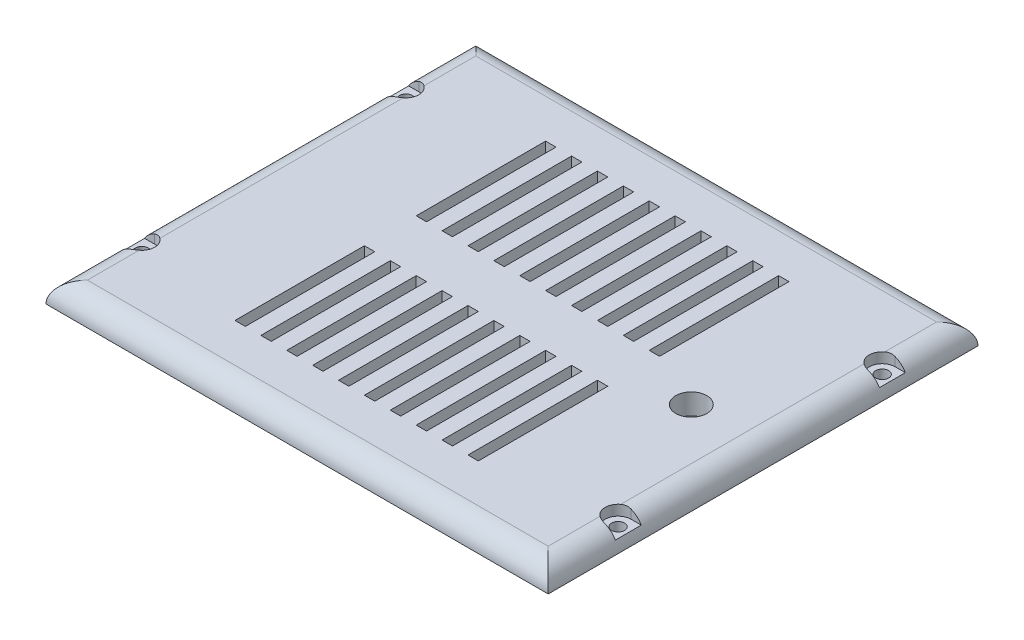
from build123d import *

# Parameters (mm, degrees)
SKETCH1_W           = 97
SKETCH1_H           = 83
BOSS_EXTRUDE1_DEPTH = 4
FILLET1_R           = 4
SKETCH3_R           = 1.25
CUT_EXTRUDE1_DEPTH  = 10
CUT_EXTRUDE2_DEPTH  = 2
SKETCH5_W           = 2
SKETCH5_H           = 25
CUT_EXTRUDE3_DEPTH  = 10
LPATTERN1_COUNT     = 10
LPATTERN1_PITCH     = 5
SKETCH6_R           = 3
CUT_EXTRUDE4_DEPTH  = 105


with BuildPart() as part:
    # Sketch1 → Boss-Extrude1 (new body)
    with BuildSketch(Plane(origin=(0, 0, 0), x_dir=(1, 0, 0), z_dir=(0, 1, 0))):
        with Locations((3.439716312, -14.541223404)):
            Rectangle(SKETCH1_W, SKETCH1_H)
    extrude(amount=BOSS_EXTRUDE1_DEPTH)

    # Fillet1
    fillet1_edges = [part.edges().sort_by_distance(p)[0] for p in [
        (3.439716312, 4, -26.958776596),
        (51.939716312, 4, 14.541223404),
        (3.439716312, 4, 56.041223404),
        (-45.060283688, 4, 14.541223404),
    ]]
    fillet(fillet1_edges, radius=FILLET1_R - 0.0001)  # a hair under: the kernel refuses the full size

    # Sketch3 → Cut-Extrude1 (cut)
    with BuildSketch(Plane.XZ):
        with Locations(Location((-42.560283688, 40.041223404, 0), (0, 0, 270))):
            Circle(SKETCH3_R)
        with Locations(Location((49.439716312, 40.041223404, 0), (0, 0, 270))):
            Circle(SKETCH3_R)
        with Locations(Location((-42.560283688, -10.958776596, 0), (0, 0, 270))):
            Circle(SKETCH3_R)
        with Locations(Location((49.439716312, -10.958776596, 0), (0, 0, 270))):
            Circle(SKETCH3_R)
    extrude(amount=-CUT_EXTRUDE1_DEPTH, mode=Mode.SUBTRACT)

    # Sketch4 → Cut-Extrude2 (cut)
    with BuildSketch(Plane(origin=(0, 4, 0), x_dir=(1, 0, 0), z_dir=(0, 1, 0))):
        with BuildLine():
            Line((-42.560283688, 13.458776596), (-49.206472021, 13.458776596))
            Line((-49.206472021, 13.458776596), (-49.206472021, 8.458776596))
            Line((-49.206472021, 8.458776596), (-42.560283688, 8.458776596))
            ThreePointArc((-42.560283688, 8.458776596), (-40.060283688, 10.958776596), (-42.560283688, 13.458776596))
        make_face()
        with BuildLine():
            Line((-42.560283688, -37.541223404), (-49.554151242, -37.541223404))
            Line((-49.554151242, -37.541223404), (-49.554151242, -42.541223404))
            Line((-49.554151242, -42.541223404), (-42.560283688, -42.541223404))
            ThreePointArc((-42.560283688, -42.541223404), (-40.060283688, -40.041223404), (-42.560283688, -37.541223404))
        make_face()
        with BuildLine():
            Line((49.439716312, 13.458776596), (53.973660089, 13.458776596))
            Line((53.973660089, 13.458776596), (53.973660089, 8.458776596))
            Line((53.973660089, 8.458776596), (49.439716312, 8.458776596))
            ThreePointArc((49.439716312, 8.458776596), (46.939716312, 10.958776596), (49.439716312, 13.458776596))
        make_face()
        with BuildLine():
            Line((49.439716312, -37.541223404), (55.815990307, -37.541223404))
            Line((55.815990307, -37.541223404), (55.815990307, -42.541223404))
            Line((55.815990307, -42.541223404), (49.439716312, -42.541223404))
            ThreePointArc((49.439716312, -42.541223404), (46.939716312, -40.041223404), (49.439716312, -37.541223404))
        make_face()
    extrude(amount=-CUT_EXTRUDE2_DEPTH, mode=Mode.SUBTRACT)

    # Sketch5 → Cut-Extrude3 (cut)
    with BuildSketch(Plane(origin=(0, 4, 0), x_dir=(1, 0, 0), z_dir=(0, 1, 0))):
        with Locations((-19.060283688, 2.958776596)):
            Rectangle(SKETCH5_W, SKETCH5_H)
        with Locations((-19.060283688, -32.041223404)):
            Rectangle(SKETCH5_W, SKETCH5_H)
    cut_extrude3 = extrude(amount=-CUT_EXTRUDE3_DEPTH, mode=Mode.SUBTRACT)

    # LPattern1: Cut-Extrude3 ×10
    with Locations(*[(i * LPATTERN1_PITCH, 0, 0) for i in range(1, LPATTERN1_COUNT)]):
        add(cut_extrude3, mode=Mode.SUBTRACT)

    # Sketch6 → Cut-Extrude4 (cut)
    with BuildSketch(Plane(origin=(0, 4, 0), x_dir=(1, 0, 0), z_dir=(0, 1, 0))):
        with Locations(Location((38.066563645, -14.541223404, 0), (0, 0, 270))):
            Circle(SKETCH6_R)
    extrude(amount=-CUT_EXTRUDE4_DEPTH, mode=Mode.SUBTRACT)


solid = part.part
